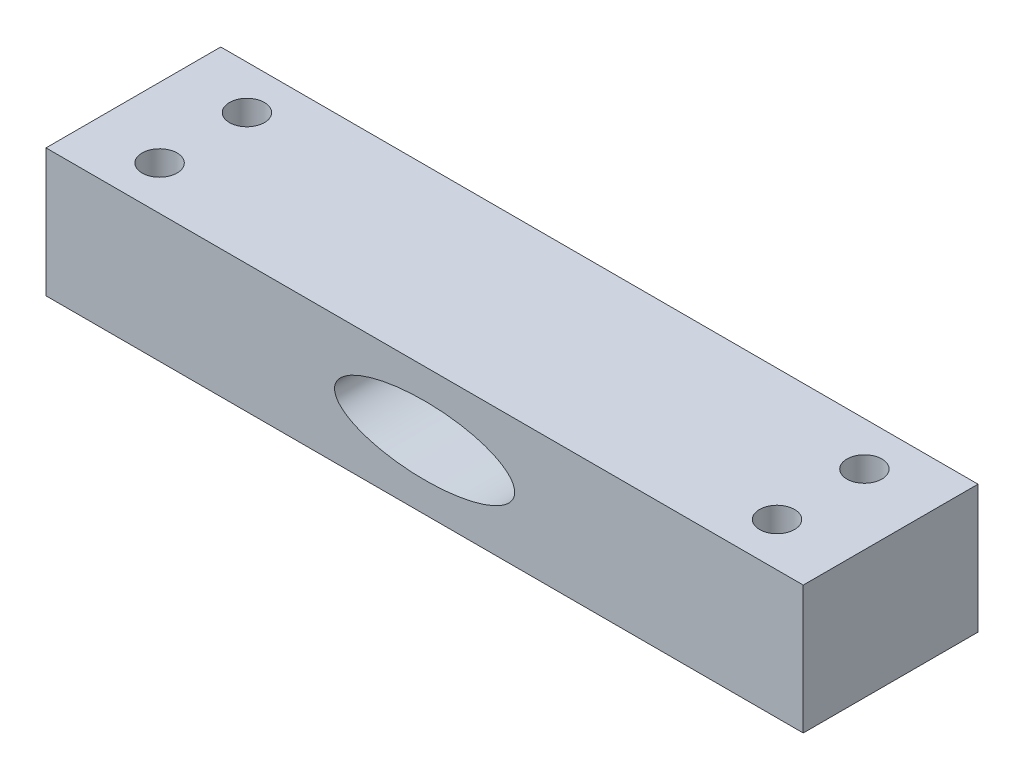
from build123d import *

# Parameters (mm, degrees)
SKETCH1_W           = 130
SKETCH1_H           = 30
BOSS_EXTRUDE1_DEPTH = 22
SKETCH2_RX          = 15.461746976
SKETCH2_RY          = 5.884694745
CUT_EXTRUDE1_DEPTH  = 75.893257373
SKETCH3_R           = 3
CUT_EXTRUDE2_DEPTH  = 71.242437461
SKETCH4_W           = 1.384926884
SKETCH4_H           = 15.203419573
CUT_EXTRUDE3_DEPTH  = 2


with BuildPart() as part:
    # Sketch1 → Boss-Extrude1 (new body)
    with BuildSketch(Plane(origin=(0, 0, 0), x_dir=(1, 0, 0), z_dir=(0, 1, 0))):
        Rectangle(SKETCH1_W, SKETCH1_H)
    extrude(amount=BOSS_EXTRUDE1_DEPTH)

    # Sketch2 → Cut-Extrude1 (cut, through all)
    with BuildSketch(Plane.XY.offset(15)):
        with Locations((0, 11)):
            Ellipse(SKETCH2_RX, SKETCH2_RY)
    extrude(amount=-CUT_EXTRUDE1_DEPTH, mode=Mode.SUBTRACT)

    # Sketch3 → Cut-Extrude2 (cut, through all)
    with BuildSketch(Plane(origin=(0, 22, 0), x_dir=(1, 0, 0), z_dir=(0, 1, 0))):
        with Locations((-53, 7.5)):
            Circle(SKETCH3_R)
        with Locations((53, 7.5)):
            Circle(SKETCH3_R)
        with Locations((53, -7.5)):
            Circle(SKETCH3_R)
        with Locations((-53, -7.5)):
            Circle(SKETCH3_R)
    extrude(amount=-CUT_EXTRUDE2_DEPTH, mode=Mode.SUBTRACT)

    # Sketch4 → Cut-Extrude3 (cut)
    with BuildSketch(Plane.ZY.offset(65)):
        with Locations((0, 9.722789651)):
            Rectangle(SKETCH4_W, SKETCH4_H)
    extrude(amount=-CUT_EXTRUDE3_DEPTH, mode=Mode.SUBTRACT)


solid = part.part
